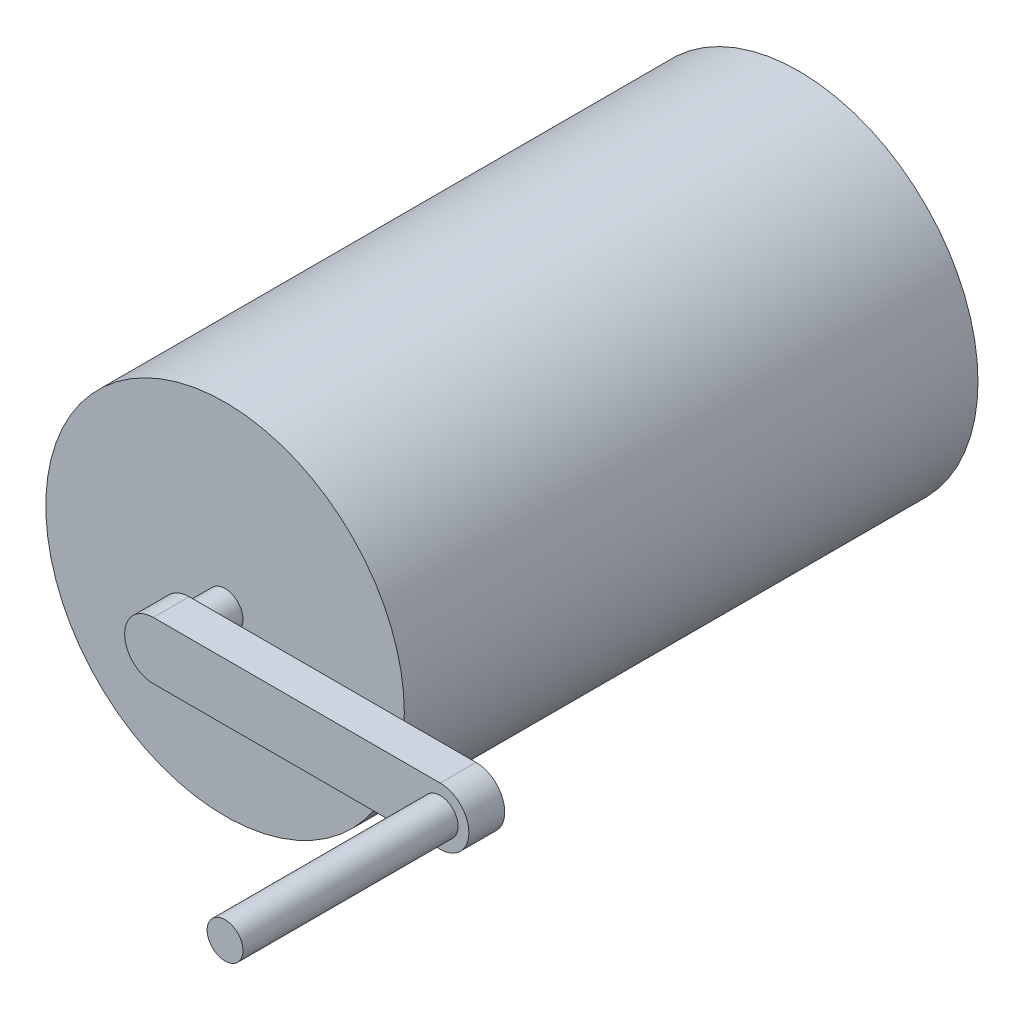
from build123d import *

# Parameters (mm, degrees)
SKETCH1_R           = 15.875
BOSS_EXTRUDE1_DEPTH = 50.8
SKETCH2_R           = 1.5875
BOSS_EXTRUDE2_DEPTH = 6.35
BOSS_EXTRUDE3_DEPTH = 3.175
SKETCH4_R           = 1.5875
BOSS_EXTRUDE4_DEPTH = 19.05


with BuildPart() as part:
    # Sketch1 → Boss-Extrude1 (new body)
    with BuildSketch(Plane.XY):
        Circle(SKETCH1_R)
    extrude(amount=BOSS_EXTRUDE1_DEPTH)

    # Sketch2 → Boss-Extrude2 (add)
    with BuildSketch(Plane.XY.offset(50.8)):
        Circle(SKETCH2_R)
    extrude(amount=BOSS_EXTRUDE2_DEPTH)

    # Sketch3 → Boss-Extrude3 (add)
    with BuildSketch(Plane.XY.offset(57.15)):
        with BuildLine():
            Line((0, 2.54), (25.4, 2.54))
            ThreePointArc((25.4, 2.54), (27.94, 0), (25.4, -2.54))
            Line((25.4, -2.54), (0, -2.54))
            ThreePointArc((0, -2.54), (-2.54, 0), (0, 2.54))
        make_face()
    extrude(amount=-BOSS_EXTRUDE3_DEPTH)

    # Sketch4 → Boss-Extrude4 (add)
    with BuildSketch(Plane.XY.offset(57.15)):
        with Locations((25.4, 0)):
            Circle(SKETCH4_R)
    extrude(amount=BOSS_EXTRUDE4_DEPTH)


solid = part.part
